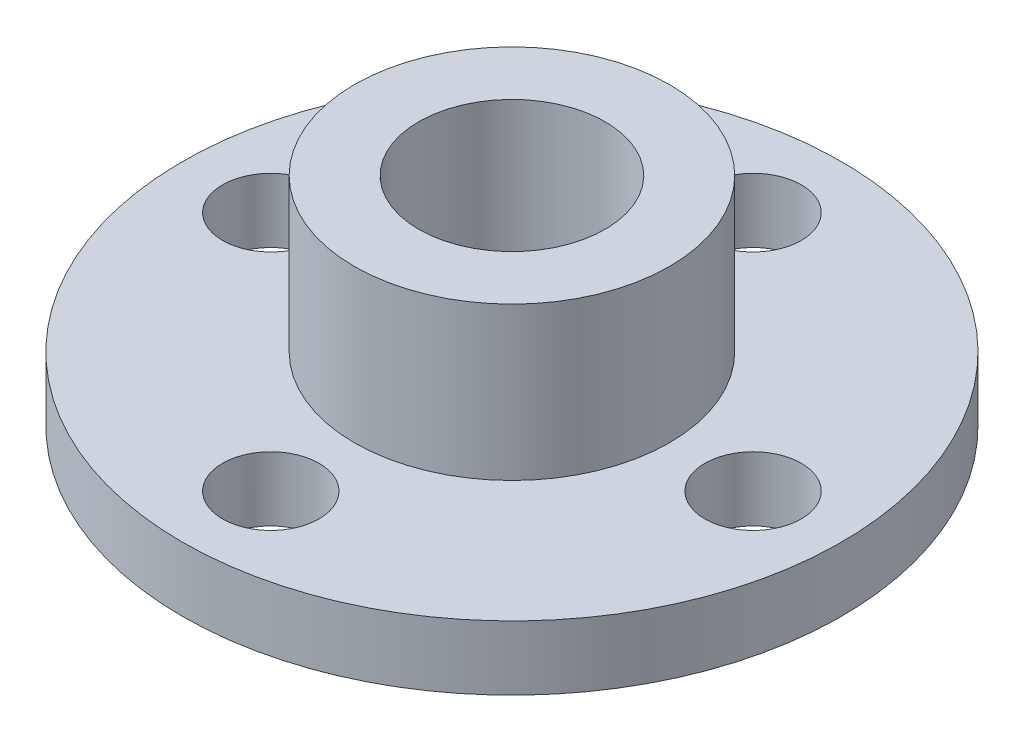
from build123d import *

# Parameters (mm, degrees)
SKETCH1_R           = 10.25
BOSS_EXTRUDE1_DEPTH = 2
SKETCH2_R           = 1.5
CUT_EXTRUDE1_DEPTH  = 3
SKETCH3_R           = 4.9
SKETCH3_R_2         = 2.9
BOSS_EXTRUDE2_DEPTH = 4.75


with BuildPart() as part:
    # Sketch1 → Boss-Extrude1 (new body)
    with BuildSketch(Plane(origin=(0, 0, 0), x_dir=(1, 0, 0), z_dir=(0, 1, 0))):
        Circle(SKETCH1_R)
    extrude(amount=BOSS_EXTRUDE1_DEPTH)

    # Sketch2 → Cut-Extrude1 (cut)
    with BuildSketch(Plane(origin=(0, 2, 0), x_dir=(1, 0, 0), z_dir=(0, 1, 0))):
        with Locations((7.5, 0)):
            Circle(SKETCH2_R)
        Circle(SKETCH2_R)
        with Locations((0, 7.5)):
            Circle(SKETCH2_R)
        with Locations((-7.5, 0)):
            Circle(SKETCH2_R)
        with Locations((0, -7.5)):
            Circle(SKETCH2_R)
    extrude(amount=-CUT_EXTRUDE1_DEPTH, mode=Mode.SUBTRACT)

    # Sketch3 → Boss-Extrude2 (add)
    with BuildSketch(Plane(origin=(0, 2, 0), x_dir=(1, 0, 0), z_dir=(0, 1, 0))):
        Circle(SKETCH3_R)
        Circle(SKETCH3_R_2, mode=Mode.SUBTRACT)
    extrude(amount=BOSS_EXTRUDE2_DEPTH)


solid = part.part
